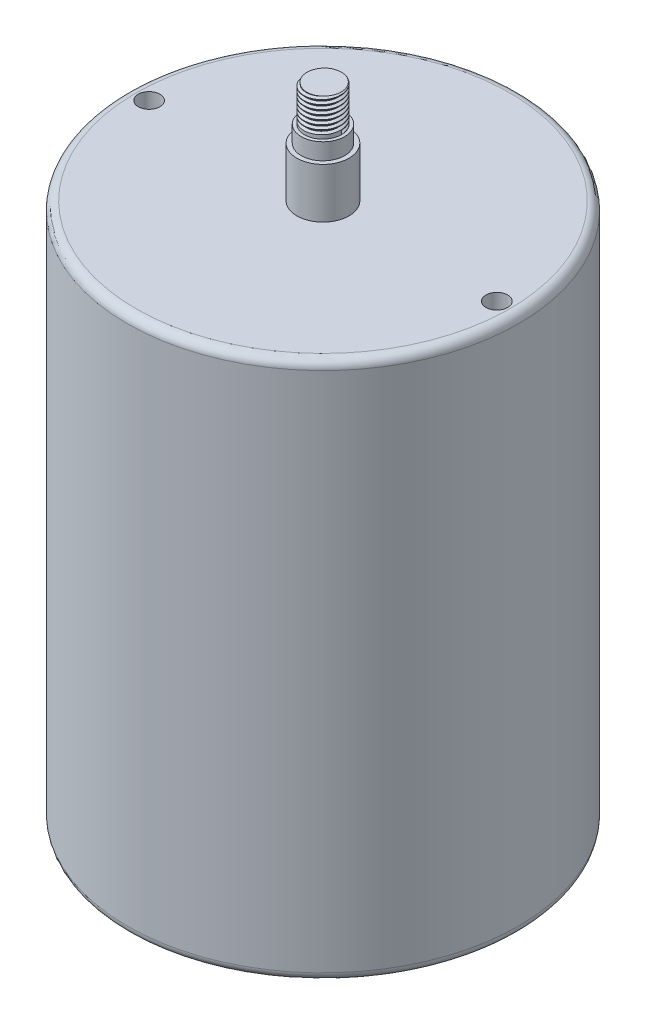
from build123d import *
from build123d.topology import SkipClean

# Parameters (mm, degrees)
SKETCH1_R                        = 45
BOSS_EXTRUDE1_DEPTH              = 124
SKETCH2_R                        = 6
BOSS_EXTRUDE4_DEPTH              = 11.5
SKETCH4_R                        = 5
BOSS_EXTRUDE5_DEPTH              = 3.8
SKETCH5_R                        = 4.25
BOSS_EXTRUDE6_DEPTH              = 8.2
THREAD1_PITCH                    = 1
SKETCH22_W                       = 2.5
SKETCH22_H                       = 124
TAP_DRILL_FOR_M6_TAP2_AT_2_COUNT = 2
TAP_DRILL_FOR_M6_TAP2_AT_2_PITCH = 80
FILLET1_R                        = 2


with BuildPart() as part:
    # Sketch1 → Boss-Extrude1 (new body)
    with BuildSketch(Plane(origin=(0, 0, 0), x_dir=(1, 0, 0), z_dir=(0, 1, 0))):
        with Locations(Location((0, 0, 0), (0, 0, 270))):
            Circle(SKETCH1_R)
    extrude(amount=BOSS_EXTRUDE1_DEPTH)

    # Sketch22 → Tap Drill for M6 Tap2 (revolve, cut)
    with BuildSketch(Plane(origin=(-40, 124, 0), x_dir=(0, 0, 1), z_dir=(1, 0, 0))):
        with Locations((1.25, 62)):
            Rectangle(SKETCH22_W, SKETCH22_H)
    tap_drill_for_m6_tap2 = revolve(axis=Axis((-40, 130.35, 0), (0, -1, 0)), mode=Mode.SUBTRACT)

    # Tap Drill for M6 Tap2 at 2: Tap Drill for M6 Tap2 ×2
    with Locations(*[(i * TAP_DRILL_FOR_M6_TAP2_AT_2_PITCH, 0, 0) for i in range(1, TAP_DRILL_FOR_M6_TAP2_AT_2_COUNT)]):
        add(tap_drill_for_m6_tap2, mode=Mode.SUBTRACT)

    # Fillet1
    fillet1_edges = [part.edges().sort_by_distance(p)[0] for p in [
        (0, 0, -45),
        (0, 124, -45),
    ]]
    fillet(fillet1_edges, radius=FILLET1_R)


with BuildPart() as body_2:
    # Sketch2 → Boss-Extrude4 (new body)
    with BuildSketch(Plane(origin=(0, 124, 0), x_dir=(1, 0, 0), z_dir=(0, 1, 0))):
        with Locations(Location((0, 0, 0), (0, 0, 270))):
            Circle(SKETCH2_R)
    extrude(amount=BOSS_EXTRUDE4_DEPTH)

    # Sketch4 → Boss-Extrude5 (add)
    with BuildSketch(Plane(origin=(0, 135.5, 0), x_dir=(1, 0, 0), z_dir=(0, 1, 0))):
        with Locations(Location((0, 0, 0), (0, 0, 90))):
            Circle(SKETCH4_R)
    extrude(amount=BOSS_EXTRUDE5_DEPTH)

    # Sketch5 → Boss-Extrude6 (add)
    with BuildSketch(Plane(origin=(0, 139.3, 0), x_dir=(1, 0, 0), z_dir=(0, 1, 0))):
        with Locations(Location((0, 0, 0), (0, 0, 270))):
            Circle(SKETCH5_R)
    extrude(amount=BOSS_EXTRUDE6_DEPTH)

    # Thread1: the profile of Sketch7 profile screwed along a right-hand helix of 8.2 turns, 8 arcs to a turn; built about Z, then put on its axis
    with SkipClean():  # the faces are left unmerged after this step: merging them gives an invalid solid
        thread1_z = Axis((0, 0, 0), (0, 0, 1))
        thread1_corners = [(4.2503, 0, -0.000173205), (4.2503, 0, 0.875173202), (3.708734125, 0, 0.562499999), (3.708734125, 0, 0.312499999)]
        with BuildLine(mode=Mode.PRIVATE) as thread1_profile:
            Line(thread1_corners[0], thread1_corners[1])
            Line(thread1_corners[1], thread1_corners[2])
            Line(thread1_corners[2], thread1_corners[3])
            Line(thread1_corners[3], thread1_corners[0])
        thread1_cap = Face(thread1_profile.wire())
        thread1_turn_angles = [0, 22.5, 45, 67.5, 90, 112.5, 135, 157.5, 180, 202.5, 225, 247.5, 270, 292.5, 315, 337.5, 360]
        thread1_turn_weights = [1, 0.9238795325112867, 1, 0.9238795325112867, 1, 0.9238795325112867, 1, 0.9238795325112867, 1, 0.9238795325112867, 1, 0.9238795325112867, 1, 0.9238795325112867, 1, 0.9238795325112867, 1]
        thread1_turn_rails = [Edge.make_bspline([Vector(p[0], p[1], 0).rotate(thread1_z, thread1_turn_angles[k]) / thread1_turn_weights[k] + Vector(0, 0, p[2] + THREAD1_PITCH * thread1_turn_angles[k] / 360) for k in range(17)], [0, 0, 0, 1, 1, 2, 2, 3, 3, 4, 4, 5, 5, 6, 6, 7, 7, 8, 8, 8], 2, thread1_turn_weights) for p in thread1_corners]
        thread1_turn_sides = [Face.make_surface_from_curves(thread1_turn_rails[p[0]], thread1_turn_rails[p[1]]) for p in [(0, 1), (1, 2), (2, 3), (3, 0)]]
        thread1_last_angles = [2880, 2902.5, 2925, 2938.5, 2952]
        thread1_last_weights = [1, 0.9238795325112867, 1, 0.9723699203976665, 1]
        thread1_last_rails = [Edge.make_bspline([Vector(p[0], p[1], 0).rotate(thread1_z, thread1_last_angles[k]) / thread1_last_weights[k] + Vector(0, 0, p[2] + THREAD1_PITCH * thread1_last_angles[k] / 360) for k in range(5)], [0, 0, 0, 1, 1, 2, 2, 2], 2, thread1_last_weights) for p in thread1_corners]
        thread1_last_sides = [Face.make_surface_from_curves(thread1_last_rails[p[0]], thread1_last_rails[p[1]]) for p in [(0, 1), (1, 2), (2, 3), (3, 0)]]
        thread1 = Plane(origin=(0, 139.3, 0), x_dir=(1, 0, 0), z_dir=(0, 1, 0)) * Solid(Shell([*[p.moved(Location((0, 0, THREAD1_PITCH * i))) for i in range(8) for p in thread1_turn_sides], *thread1_last_sides, thread1_cap, thread1_cap.rotate(thread1_z, 2952).moved(Location((0, 0, THREAD1_PITCH * 2952 / 360)))]))
        add(thread1, mode=Mode.SUBTRACT)


solid = Compound([part.part, body_2.part])
